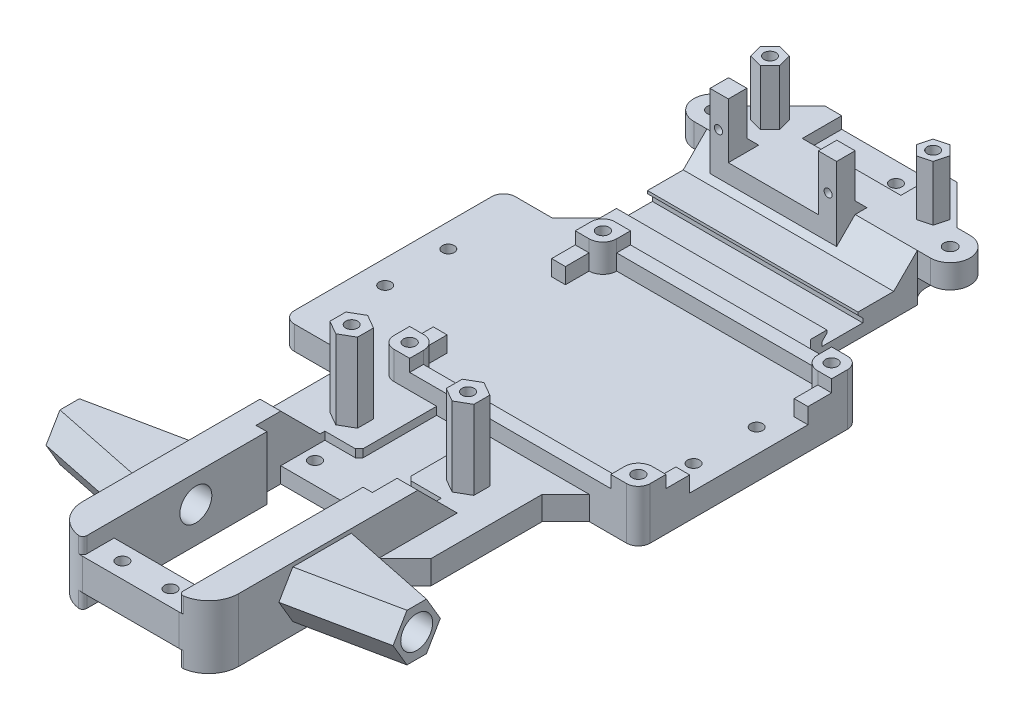
from build123d import *
from OCP.BRepFilletAPI import BRepFilletAPI_MakeChamfer
from build123d.topology import SkipClean

# Parameters (mm, degrees)
SKETCH1_R                 = 1.6
BOSS_EXTRUDE1_DEPTH       = 6
BOSS_EXTRUDE2_DEPTH       = 6
SKETCH3_W                 = 53.36675042
SKETCH3_H                 = 6
BOSS_EXTRUDE3_DEPTH       = 120
CUT_EXTRUDE1_DEPTH        = 58
CHAMFER1_SIZE             = 1
CHAMFER1_SIZE2            = 0.707106781
SKETCH7_W                 = 4.64125
SKETCH7_H                 = 4.7
BOSS_EXTRUDE5_DEPTH       = 20
SKETCH8_W                 = 22.8175
SKETCH8_H                 = 6
BOSS_EXTRUDE6_DEPTH       = 4.7
SKETCH9_R                 = 1.025
CUT_EXTRUDE2_DEPTH        = 18
SKETCH12_W                = 90.2
SKETCH12_H                = 56
BOSS_EXTRUDE11_DEPTH      = 6
SKETCH16_R                = 1.55
CUT_EXTRUDE3_DEPTH        = 13.1
SKETCH17_W                = 65
SKETCH17_H                = 56
SKETCH17_R                = 1.55
BOSS_EXTRUDE12_DEPTH      = 4
SKETCH18_R                = 1.55
BOSS_EXTRUDE13_DEPTH      = 3.1
SKETCH16_3_W              = 8.5
SKETCH16_3_H              = 11
SKETCH16_3_R              = 1.55
SKETCH16_3_W_2            = 12.1
CUT_EXTRUDE4_DEPTH        = 2
BOSS_EXTRUDE15_DEPTH      = 10
BOSS_EXTRUDE15_DEPTH_BACK = 6
CHAMFER2_SIZE             = 10
CHAMFER3_SIZE             = 10
SKETCH20_R                = 4.05
CUT_EXTRUDE5_DEPTH        = 47
BOSS_EXTRUDE16_START      = 0.4
SKETCH21_R                = 6
SKETCH21_R_2              = 4.05
BOSS_EXTRUDE16_DEPTH      = 0.4
SKETCH26_W                = 12
SKETCH26_H                = 12
BOSS_EXTRUDE17_DEPTH      = 24
CHAMFER5_SIZE             = 4.95
CHAMFER5_SIZE_2           = 24
CHAMFER8_SIZE             = 4.95
CHAMFER8_SIZE_2           = 24
CUT_EXTRUDE8_DEPTH        = 76
CUT_EXTRUDE8_DEPTH_BACK   = 24
SKETCH28_R                = 4.05
CUT_EXTRUDE9_START        = -9
SKETCH17_2_R              = 1.55
CUT_EXTRUDE9_DEPTH        = 9
CHAMFER10_SIZE            = 6
FILLET2_R                 = 3
CHAMFER11_SIZE            = 1
CHAMFER12_SIZE            = 3
FILLET3_R                 = 8
SKETCH29_W                = 30
SKETCH29_H                = 4
CUT_EXTRUDE10_DEPTH       = 97
SKETCH30_R                = 1.525
CUT_EXTRUDE11_DEPTH       = 9
SKETCH32_W                = 53.36675042
SKETCH32_H                = 10
BOSS_EXTRUDE18_DEPTH      = 12
CHAMFER13_SIZE            = 10
CHAMFER14_START           = -26.68337521
CHAMFER14_DEPTH           = 53.36675042
SKETCH33_W                = 25
SKETCH33_H                = 3
CUT_EXTRUDE12_DEPTH       = 10
SKETCH34_R                = 1.525
CUT_EXTRUDE13_DEPTH       = 10
SKETCH38_R                = 1.525
BOSS_EXTRUDE19_DEPTH      = 14
SKETCH39_R                = 1.525
BOSS_EXTRUDE20_DEPTH      = 20
FILLET4_R                 = 7.6
SKETCH40_W                = 24.4
SKETCH40_H                = 4
CUT_EXTRUDE14_DEPTH       = 10
FILLET6_R                 = 1
SKETCH42_R                = 1.525
CUT_EXTRUDE15_DEPTH       = 10


with BuildPart() as part:
    # Sketch1 → Boss-Extrude1 (new body)
    with BuildSketch(Plane(origin=(0, 0, 0), x_dir=(1, 0, 0), z_dir=(0, 1, 0))):
        with BuildLine():
            Line((-30, 5), (30, 5))
            ThreePointArc((30, 5), (35, 0), (30, -5))
            Line((30, -5), (-30, -5))
            ThreePointArc((-30, -5), (-35, 0), (-30, 5))
        make_face()
        with Locations(Location((-30, 0, 0), (0, 0, 270))):
            Circle(SKETCH1_R, mode=Mode.SUBTRACT)
        with Locations(Location((30, 0, 0), (0, 0, 270))):
            Circle(SKETCH1_R, mode=Mode.SUBTRACT)
    extrude(amount=BOSS_EXTRUDE1_DEPTH)

    # Sketch2 → Boss-Extrude2 (add)
    with BuildSketch(Plane.XZ):
        with BuildLine():
            Line((26.68337521, 5), (-26.68337521, 5))
            ThreePointArc((-26.68337521, 5), (-24, 0), (-26.68337521, -5))
            Line((-26.68337521, -5), (26.68337521, -5))
            ThreePointArc((26.68337521, -5), (24, 0), (26.68337521, 5))
        make_face()
    extrude(amount=BOSS_EXTRUDE2_DEPTH)

    # Sketch3 → Boss-Extrude3 (add)
    with BuildSketch(Plane.XY.offset(5)):
        with Locations((0, -3)):
            Rectangle(SKETCH3_W, SKETCH3_H)
    extrude(amount=BOSS_EXTRUDE3_DEPTH)

    # Sketch6 → Cut-Extrude1 (cut)
    with BuildSketch(Plane.ZY.offset(26.68337521)):
        Polygon((27.06627417, 0.16), (20.93372583, 0.16), (18.84, -1.93372583), (18.84, -3.00125), (29.16, -3.00125), (29.16, -1.93372583), align=None)
    extrude(amount=-CUT_EXTRUDE1_DEPTH, mode=Mode.SUBTRACT)

    # Chamfer1: one chamfer whose edges measure the first distance from different faces: ONE call of the kernel's chamfer builder (chamfer() names one face for all edges)
    chamfer1_edges_1 = [part.edges().sort_by_distance(p)[0] for p in [
        (0, 0, 27.22627417),
    ]]
    chamfer1_side_1 = [part.faces().sort_by_distance(p)[0] for p in [
        (0, -0.966862915, 28.193137085),
    ]]
    chamfer1_edges_2 = [part.edges().sort_by_distance(p)[0] for p in [
        (0, 0, 20.77372583),
    ]]
    chamfer1_side_2 = [part.faces().sort_by_distance(p)[0] for p in [
        (0, -0.966862915, 19.806862915),
    ]]
    chamfer1 = BRepFilletAPI_MakeChamfer(part.part.solid().wrapped)
    for e in chamfer1_edges_1:
        chamfer1.Add(CHAMFER1_SIZE, CHAMFER1_SIZE2, e.wrapped, chamfer1_side_1[0].wrapped)  # the first distance lies on this face
    for e in chamfer1_edges_2:
        chamfer1.Add(CHAMFER1_SIZE, CHAMFER1_SIZE2, e.wrapped, chamfer1_side_2[0].wrapped)  # the first distance lies on this face
    add(Compound.cast(chamfer1.Shape()), mode=Mode.REPLACE)

    # Sketch7 → Boss-Extrude5 (add)
    with BuildSketch(Plane(origin=(0, 0, 0), x_dir=(1, 0, 0), z_dir=(0, 1, 0))):
        with Locations((-18.879375, -7.35)):
            Rectangle(SKETCH7_W, SKETCH7_H)
        with Locations((8.579375, -7.35)):
            Rectangle(SKETCH7_W, SKETCH7_H)
    extrude(amount=BOSS_EXTRUDE5_DEPTH)

    # Sketch8 → Boss-Extrude6 (add)
    with BuildSketch(Plane.XY.offset(5)):
        with Locations((-5.15, 3)):
            Rectangle(SKETCH8_W, SKETCH8_H)
    extrude(amount=BOSS_EXTRUDE6_DEPTH)

    # Sketch9 → Cut-Extrude2 (cut)
    with BuildSketch(Plane.XY.offset(9.7)):
        with Locations((-19.05, 12)):
            Circle(SKETCH9_R)
        with Locations((8.75, 12)):
            Circle(SKETCH9_R)
    extrude(amount=-CUT_EXTRUDE2_DEPTH, mode=Mode.SUBTRACT)

    # Sketch12 → Boss-Extrude11 (add, through all)
    with BuildSketch(Plane(origin=(0, 0, 0), x_dir=(1, 0, 0), z_dir=(0, 1, 0))):
        with Locations((0, -66.16)):
            Rectangle(SKETCH12_W, SKETCH12_H)
    extrude(amount=-BOSS_EXTRUDE11_DEPTH)

    # Sketch16 → Cut-Extrude3 (cut)
    with BuildSketch(Plane(origin=(0, 0, 0), x_dir=(1, 0, 0), z_dir=(0, 1, 0))):
        with Locations(Location((-11.55, -119.5, 0), (0, 0, 270))):
            Circle(SKETCH16_R)
        with Locations(Location((11.55, -119.5, 0), (0, 0, 270))):
            Circle(SKETCH16_R)
    extrude(amount=-CUT_EXTRUDE3_DEPTH, mode=Mode.SUBTRACT)

    # Sketch17 → Boss-Extrude12 (add)
    with BuildSketch(Plane(origin=(0, 0, 0), x_dir=(1, 0, 0), z_dir=(0, 1, 0))):
        with Locations((12.6, -66.16)):
            Rectangle(SKETCH17_W, SKETCH17_H)
        with Locations(Location((-16.4, -41.66, 0), (0, 0, 270))):
            Circle(SKETCH17_R, mode=Mode.SUBTRACT)
        with Locations(Location((41.6, -41.66, 0), (0, 0, 270))):
            Circle(SKETCH17_R, mode=Mode.SUBTRACT)
        with Locations(Location((41.6, -90.66, 0), (0, 0, 270))):
            Circle(SKETCH17_R, mode=Mode.SUBTRACT)
        with Locations(Location((-16.4, -90.66, 0), (0, 0, 270))):
            Circle(SKETCH17_R, mode=Mode.SUBTRACT)
        with BuildLine():
            Line((41.6, -45.16), (41.6, -87.16))
            ThreePointArc((41.6, -87.16), (39.125126266, -88.185126266), (38.1, -90.66))
            Line((38.1, -90.66), (-12.9, -90.66))
            ThreePointArc((-12.9, -90.66), (-13.925126266, -88.185126266), (-16.4, -87.16))
            Line((-16.4, -87.16), (-16.4, -45.16))
            ThreePointArc((-16.4, -45.16), (-13.925126266, -44.134873734), (-12.9, -41.66))
            Line((-12.9, -41.66), (38.1, -41.66))
            ThreePointArc((38.1, -41.66), (39.125126266, -44.134873734), (41.6, -45.16))
        make_face(mode=Mode.SUBTRACT)
    extrude(amount=BOSS_EXTRUDE12_DEPTH)

    # Sketch18 → Boss-Extrude13 (add)
    # profile 1 of 4: a face of its own
    with BuildSketch(Plane(origin=(0, 4, 0), x_dir=(1, 0, 0), z_dir=(0, 1, 0))):
        with BuildLine():
            Line((-16.4, -45.16), (-19.9, -45.16))
            Line((-19.9, -45.16), (-19.9, -38.16))
            Line((-19.9, -38.16), (-12.9, -38.16))
            Line((-12.9, -38.16), (-12.9, -41.66))
            ThreePointArc((-12.9, -41.66), (-13.925126266, -44.134873734), (-16.4, -45.16))
        make_face()
        with Locations(Location((-16.4, -41.66, 0), (0, 0, 270))):
            Circle(SKETCH18_R, mode=Mode.SUBTRACT)
    # profile 2 of 4: a face of its own
    with BuildSketch(Plane(origin=(0, 4, 0), x_dir=(1, 0, 0), z_dir=(0, 1, 0))):
        with BuildLine():
            Line((-16.4, -87.16), (-19.9, -87.16))
            Line((-19.9, -87.16), (-19.9, -94.16))
            Line((-19.9, -94.16), (-12.9, -94.16))
            Line((-12.9, -94.16), (-12.9, -90.66))
            ThreePointArc((-12.9, -90.66), (-13.925126266, -88.185126266), (-16.4, -87.16))
        make_face()
        with Locations(Location((-16.4, -90.66, 0), (0, 0, 270))):
            Circle(SKETCH18_R, mode=Mode.SUBTRACT)
    # profile 3 of 4: a face of its own
    with BuildSketch(Plane(origin=(0, 4, 0), x_dir=(1, 0, 0), z_dir=(0, 1, 0))):
        with BuildLine():
            Line((38.1, -94.16), (38.1, -90.66))
            ThreePointArc((38.1, -90.66), (39.125126266, -88.185126266), (41.6, -87.16))
            Line((41.6, -87.16), (45.1, -87.16))
            Line((45.1, -87.16), (45.1, -94.16))
            Line((45.1, -94.16), (38.1, -94.16))
        make_face()
        with Locations(Location((41.6, -90.66, 0), (0, 0, 90))):
            Circle(SKETCH18_R, mode=Mode.SUBTRACT)
    # profile 4 of 4: a face of its own
    with BuildSketch(Plane(origin=(0, 4, 0), x_dir=(1, 0, 0), z_dir=(0, 1, 0))):
        with BuildLine():
            Line((38.1, -38.16), (38.1, -41.66))
            ThreePointArc((38.1, -41.66), (39.125126266, -44.134873734), (41.6, -45.16))
            Line((41.6, -45.16), (45.1, -45.16))
            Line((45.1, -45.16), (45.1, -38.16))
            Line((45.1, -38.16), (38.1, -38.16))
        make_face()
        with Locations(Location((41.6, -41.66, 0), (0, 0, 90))):
            Circle(SKETCH18_R, mode=Mode.SUBTRACT)
    extrude(amount=BOSS_EXTRUDE13_DEPTH)

    # Sketch16<3> → Cut-Extrude4 (cut)
    # profile 1 of 6: a face of its own
    with BuildSketch(Plane(origin=(0, 0, 0), x_dir=(1, 0, 0), z_dir=(0, 1, 0))):
        with Locations((-10.3, -119.5)):
            Rectangle(SKETCH16_3_W, SKETCH16_3_H)
        with Locations(Location((-11.55, -119.5, 0), (0, 0, 270))):
            Circle(SKETCH16_3_R, mode=Mode.SUBTRACT)
    # profile 2 of 6: a face of its own
    with BuildSketch(Plane(origin=(0, 0, 0), x_dir=(1, 0, 0), z_dir=(0, 1, 0))):
        with Locations((0, -119.5)):
            Rectangle(SKETCH16_3_W_2, SKETCH16_3_H)
    # profile 3 of 6: a face of its own
    with BuildSketch(Plane(origin=(0, 0, 0), x_dir=(1, 0, 0), z_dir=(0, 1, 0))):
        Polygon((-6.05, -113.8), (-6.05, -114), (6.05, -114), (6.05, -113.8), (6.05, -94.16), (-6.05, -94.16), align=None)
    # profile 4 of 6: a face of its own
    with BuildSketch(Plane(origin=(0, 0, 0), x_dir=(1, 0, 0), z_dir=(0, 1, 0))):
        with Locations((10.3, -119.5)):
            Rectangle(SKETCH16_3_W, SKETCH16_3_H)
        with Locations(Location((11.55, -119.5, 0), (0, 0, 270))):
            Circle(SKETCH16_3_R, mode=Mode.SUBTRACT)
    # profile 5 of 6: a face of its own
    with BuildSketch(Plane(origin=(0, 0, 0), x_dir=(1, 0, 0), z_dir=(0, 1, 0))):
        Polygon((-14.55, -114), (-6.05, -114), (-6.05, -113.8), (-14.75, -113.8), (-14.75, -125), (-14.55, -125), align=None)
    # profile 6 of 6: a face of its own
    with BuildSketch(Plane(origin=(0, 0, 0), x_dir=(1, 0, 0), z_dir=(0, 1, 0))):
        Polygon((6.05, -113.8), (6.05, -114), (14.55, -114), (14.55, -125), (14.75, -125), (14.75, -113.8), align=None)
    extrude(amount=-CUT_EXTRUDE4_DEPTH, mode=Mode.SUBTRACT)

    # Sketch19 → Boss-Extrude15 (add, two sides: drawn at the far end of the back side and taken through both)
    with BuildSketch(Plane(origin=(0, 0, 0), x_dir=(1, 0, 0), z_dir=(0, 1, 0)).offset(-BOSS_EXTRUDE15_DEPTH_BACK)):
        Polygon((-14.75, -125), (-20, -125), (-20, -178), (20, -178), (20, -125), (14.75, -125), (14.75, -131.262219981), (12.4, -131.262219981), (12.4, -170), (12, -170), (-12, -170), (-12, -131.262219981), (-14.75, -131.262219981), align=None)
    extrude(amount=BOSS_EXTRUDE15_DEPTH + BOSS_EXTRUDE15_DEPTH_BACK)

    # Chamfer2
    # the kernel refuses this chamfer: 10 mm, written as the material it adds along each edge
    with BuildSketch(Plane(origin=(20, -6, 125), x_dir=(1, 0, 0), z_dir=(0, 1, 0))) as chamfer2_piece_1_section:
        Polygon((CHAMFER2_SIZE, 0), (0, -CHAMFER2_SIZE), (0, 0), align=None)
    chamfer2_piece_1 = extrude(amount=6, mode=Mode.PRIVATE)
    chamfer2_piece_1 = split(chamfer2_piece_1, bisect_by=Plane(origin=(26.68337521, -6, 125), z_dir=(-1, 0, 0)), keep=Keep.TOP, mode=Mode.PRIVATE)
    add(chamfer2_piece_1)
    with BuildSketch(Plane(origin=(-20, -6, 125), x_dir=(-1, 0, 0), z_dir=(0, 1, 0))) as chamfer2_piece_2_section:
        Polygon((CHAMFER2_SIZE, 0), (0, CHAMFER2_SIZE), (0, 0), align=None)
    chamfer2_piece_2 = extrude(amount=6, mode=Mode.PRIVATE)
    chamfer2_piece_2 = split(chamfer2_piece_2, bisect_by=Plane(origin=(-26.68337521, -6, 125), z_dir=(1, 0, 0)), keep=Keep.TOP, mode=Mode.PRIVATE)
    add(chamfer2_piece_2)

    # Chamfer3
    chamfer3_edges = [part.edges().sort_by_distance(p)[0] for p in [
        (-17.375, 0, 125),
        (17.375, 0, 125),
    ]]
    chamfer(chamfer3_edges, length=CHAMFER3_SIZE - 0.0001)  # a hair under: the kernel refuses the full size

    # Sketch20 → Cut-Extrude5 (cut)
    with BuildSketch(Plane.ZY.offset(20)):
        with Locations((149.27, 3)):
            Circle(SKETCH20_R)
    cut_extrude5 = extrude(amount=-CUT_EXTRUDE5_DEPTH, mode=Mode.SUBTRACT)

    # Sketch21 → Boss-Extrude16 (add)
    with BuildSketch(Plane.ZY.offset(-12.4).offset(BOSS_EXTRUDE16_START)):
        with Locations((149.27, 3)):
            Circle(SKETCH21_R)
        with Locations((149.27, 3)):
            Circle(SKETCH21_R_2, mode=Mode.SUBTRACT)
    extrude(amount=-BOSS_EXTRUDE16_DEPTH)

    # Sketch26 → Boss-Extrude17 (add)
    with BuildSketch(Plane.ZY.offset(20)):
        with Locations((149.27, 3)):
            Rectangle(SKETCH26_W, SKETCH26_H)
    boss_extrude17 = extrude(amount=BOSS_EXTRUDE17_DEPTH)

    # Chamfer5
    chamfer5_edges_1 = [part.edges().sort_by_distance(p)[0] for p in [
        (-20, 3, 143.27),
    ]]
    chamfer5_side_1 = [part.faces().sort_by_distance(p)[0] for p in [
        (-20, 3, 143.171),
    ]]
    chamfer5_edges_2 = [part.edges().sort_by_distance(p)[0] for p in [
        (-20, 3, 155.27),
    ]]
    chamfer5_side_2 = [part.faces().sort_by_distance(p)[0] for p in [
        (-20, 3, 155.369),
    ]]
    chamfer5 = BRepFilletAPI_MakeChamfer(part.part.solid().wrapped)
    for e in chamfer5_edges_1:
        chamfer5.Add(CHAMFER5_SIZE - 0.0001, CHAMFER5_SIZE_2 - 0.0001, e.wrapped, chamfer5_side_1[0].wrapped)
    for e in chamfer5_edges_2:
        chamfer5.Add(CHAMFER5_SIZE - 0.0001, CHAMFER5_SIZE_2 - 0.0001, e.wrapped, chamfer5_side_2[0].wrapped)
    add(Compound.cast(chamfer5.Shape()), mode=Mode.REPLACE)  # a hair under: the kernel refuses the full size

    # Chamfer6
    # the kernel refuses this chamfer: 6, 3.464101615 mm, written as the material it takes off along each edge
    with BuildSketch(Plane(origin=(-4.797458733, 9, 163.355373857), x_dir=(0, -1, 0), z_dir=(-0.9793865059209337, 0, -0.20199522771586734))) as chamfer6_piece_1_section:
        with BuildLine():
            Line((6.207846097, 0.12), (-0.207846097, -3.584101615))
            Line((-0.207846097, -3.584101615), (-0.327846097, -3.584101615))
            ThreePointArc((-0.327846097, -3.584101615), (-0.12, -1.792050808), (-0.12, 0))
            Line((-0.12, 0), (0, 0.12))
            ThreePointArc((0, 0.12), (3.103923048, 0.12), (6.207846097, 0.24))
            Line((6.207846097, 0.24), (6.207846097, 0.12))
        make_face()
    chamfer6_piece_1 = extrude(amount=55.550063437, mode=Mode.PRIVATE)
    chamfer6_piece_1 = split(chamfer6_piece_1, bisect_by=Plane(origin=(-20, 9, 163.355373857), z_dir=(-1, 0, 0)), keep=Keep.TOP, mode=Mode.PRIVATE)
    add(chamfer6_piece_1, mode=Mode.SUBTRACT)
    with BuildSketch(Plane(origin=(-4.797458733, -3, 163.355373857), x_dir=(0, 1, 0), z_dir=(-0.9793865059209337, 0, -0.20199522771586734))) as chamfer6_piece_2_section:
        with BuildLine():
            Line((6.207846097, -0.12), (-0.207846097, 3.584101615))
            Line((-0.207846097, 3.584101615), (-0.327846097, 3.584101615))
            ThreePointArc((-0.327846097, 3.584101615), (-0.12, 1.792050808), (-0.12, 0))
            Line((-0.12, 0), (0, -0.12))
            ThreePointArc((0, -0.12), (3.103923048, -0.12), (6.207846097, -0.24))
            Line((6.207846097, -0.24), (6.207846097, -0.12))
        make_face()
    chamfer6_piece_2 = extrude(amount=55.550063437, mode=Mode.PRIVATE)
    chamfer6_piece_2 = split(chamfer6_piece_2, bisect_by=Plane(origin=(-20, -3, 163.355373857), z_dir=(-1, 0, 0)), keep=Keep.TOP, mode=Mode.PRIVATE)
    add(chamfer6_piece_2, mode=Mode.SUBTRACT)
    with BuildSketch(Plane(origin=(-4.797458733, -3, 135.184626143), x_dir=(0.20199522771586728, 0, 0.9793865059209336), z_dir=(-0.9793865059209337, 0, 0.20199522771586734))) as chamfer6_piece_3_section:
        with BuildLine():
            Line((3.584101615, -0.207846097), (-0.12, 6.207846097))
            Line((-0.12, 6.207846097), (-0.24, 6.207846097))
            ThreePointArc((-0.24, 6.207846097), (-0.12, 3.103923048), (-0.12, 0))
            Line((-0.12, 0), (0, -0.12))
            ThreePointArc((0, -0.12), (1.792050808, -0.12), (3.584101615, -0.327846097))
            Line((3.584101615, -0.327846097), (3.584101615, -0.207846097))
        make_face()
    chamfer6_piece_3 = extrude(amount=55.550063437, mode=Mode.PRIVATE)
    chamfer6_piece_3 = split(chamfer6_piece_3, bisect_by=Plane(origin=(-20, -3, 135.184626143), z_dir=(-1, 0, 0)), keep=Keep.TOP, mode=Mode.PRIVATE)
    add(chamfer6_piece_3, mode=Mode.SUBTRACT)
    with BuildSketch(Plane(origin=(-4.797458733, 9, 135.184626143), x_dir=(0, -1, 0), z_dir=(-0.9793865059209337, 0, 0.20199522771586734))) as chamfer6_piece_4_section:
        with BuildLine():
            Line((6.207846097, -0.12), (-0.207846097, 3.584101615))
            Line((-0.207846097, 3.584101615), (-0.327846097, 3.584101615))
            ThreePointArc((-0.327846097, 3.584101615), (-0.12, 1.792050808), (-0.12, 0))
            Line((-0.12, 0), (0, -0.12))
            ThreePointArc((0, -0.12), (3.103923048, -0.12), (6.207846097, -0.24))
            Line((6.207846097, -0.24), (6.207846097, -0.12))
        make_face()
    chamfer6_piece_4 = extrude(amount=55.550063437, mode=Mode.PRIVATE)
    chamfer6_piece_4 = split(chamfer6_piece_4, bisect_by=Plane(origin=(-20, 9, 135.184626143), z_dir=(-1, 0, 0)), keep=Keep.TOP, mode=Mode.PRIVATE)
    add(chamfer6_piece_4, mode=Mode.SUBTRACT)

    # Mirror19: Cut-Extrude5, Boss-Extrude17 across plane
    add(cut_extrude5.mirror(Plane(origin=(0, 0, 0), x_dir=(0, 0, 1), z_dir=(1, 0, 0))), mode=Mode.SUBTRACT)
    add(boss_extrude17.mirror(Plane(origin=(0, 0, 0), x_dir=(0, 0, 1), z_dir=(1, 0, 0))))

    # Chamfer8
    chamfer8_edges_1 = [part.edges().sort_by_distance(p)[0] for p in [
        (20, 3, 143.27),
    ]]
    chamfer8_side_1 = [part.faces().sort_by_distance(p)[0] for p in [
        (20, 3, 143.171),
    ]]
    chamfer8_edges_2 = [part.edges().sort_by_distance(p)[0] for p in [
        (20, 3, 155.27),
    ]]
    chamfer8_side_2 = [part.faces().sort_by_distance(p)[0] for p in [
        (20, 3, 155.369),
    ]]
    chamfer8 = BRepFilletAPI_MakeChamfer(part.part.solid().wrapped)
    for e in chamfer8_edges_1:
        chamfer8.Add(CHAMFER8_SIZE - 0.0001, CHAMFER8_SIZE_2 - 0.0001, e.wrapped, chamfer8_side_1[0].wrapped)
    for e in chamfer8_edges_2:
        chamfer8.Add(CHAMFER8_SIZE - 0.0001, CHAMFER8_SIZE_2 - 0.0001, e.wrapped, chamfer8_side_2[0].wrapped)
    add(Compound.cast(chamfer8.Shape()), mode=Mode.REPLACE)  # a hair under: the kernel refuses the full size

    # Chamfer9
    # the kernel refuses this chamfer: 6, 3.464101615 mm, written as the material it takes off along each edge
    with BuildSketch(Plane(origin=(4.797458733, 9, 135.184626143), x_dir=(-0.20199522771586723, 0, 0.9793865059209336), z_dir=(0.9793865059209337, 0, 0.20199522771586723))) as chamfer9_piece_1_section:
        with BuildLine():
            Line((3.584101615, -0.207846097), (-0.12, 6.207846097))
            Line((-0.12, 6.207846097), (-0.24, 6.207846097))
            ThreePointArc((-0.24, 6.207846097), (-0.12, 3.103923048), (-0.12, 0))
            Line((-0.12, 0), (0, -0.12))
            ThreePointArc((0, -0.12), (1.792050808, -0.12), (3.584101615, -0.327846097))
            Line((3.584101615, -0.327846097), (3.584101615, -0.207846097))
        make_face()
    chamfer9_piece_1 = extrude(amount=55.550063437, mode=Mode.PRIVATE)
    chamfer9_piece_1 = split(chamfer9_piece_1, bisect_by=Plane(origin=(20, 9, 135.184626143), z_dir=(1, 0, 0)), keep=Keep.TOP, mode=Mode.PRIVATE)
    add(chamfer9_piece_1, mode=Mode.SUBTRACT)
    with BuildSketch(Plane(origin=(4.797458733, -3, 135.184626143), x_dir=(-0.2019952277158672, 0, 0.9793865059209336), z_dir=(0.9793865059209337, 0, 0.20199522771586723))) as chamfer9_piece_2_section:
        with BuildLine():
            Line((3.584101615, 0.207846097), (-0.12, -6.207846097))
            Line((-0.12, -6.207846097), (-0.24, -6.207846097))
            ThreePointArc((-0.24, -6.207846097), (-0.12, -3.103923048), (-0.12, 0))
            Line((-0.12, 0), (0, 0.12))
            ThreePointArc((0, 0.12), (1.792050808, 0.12), (3.584101615, 0.327846097))
            Line((3.584101615, 0.327846097), (3.584101615, 0.207846097))
        make_face()
    chamfer9_piece_2 = extrude(amount=55.550063437, mode=Mode.PRIVATE)
    chamfer9_piece_2 = split(chamfer9_piece_2, bisect_by=Plane(origin=(20, -3, 135.184626143), z_dir=(1, 0, 0)), keep=Keep.TOP, mode=Mode.PRIVATE)
    add(chamfer9_piece_2, mode=Mode.SUBTRACT)
    with BuildSketch(Plane(origin=(4.797458733, -3, 163.355373857), x_dir=(-0.20199522771586723, 0, -0.9793865059209336), z_dir=(0.9793865059209337, 0, -0.20199522771586723))) as chamfer9_piece_3_section:
        with BuildLine():
            Line((3.584101615, -0.207846097), (-0.12, 6.207846097))
            Line((-0.12, 6.207846097), (-0.24, 6.207846097))
            ThreePointArc((-0.24, 6.207846097), (-0.12, 3.103923048), (-0.12, 0))
            Line((-0.12, 0), (0, -0.12))
            ThreePointArc((0, -0.12), (1.792050808, -0.12), (3.584101615, -0.327846097))
            Line((3.584101615, -0.327846097), (3.584101615, -0.207846097))
        make_face()
    chamfer9_piece_3 = extrude(amount=55.550063437, mode=Mode.PRIVATE)
    chamfer9_piece_3 = split(chamfer9_piece_3, bisect_by=Plane(origin=(20, -3, 163.355373857), z_dir=(1, 0, 0)), keep=Keep.TOP, mode=Mode.PRIVATE)
    add(chamfer9_piece_3, mode=Mode.SUBTRACT)
    with BuildSketch(Plane(origin=(4.797458733, 9, 163.355373857), x_dir=(0, -1, 0), z_dir=(0.9793865059209337, 0, -0.20199522771586723))) as chamfer9_piece_4_section:
        with BuildLine():
            Line((6.207846097, -0.12), (-0.207846097, 3.584101615))
            Line((-0.207846097, 3.584101615), (-0.327846097, 3.584101615))
            ThreePointArc((-0.327846097, 3.584101615), (-0.12, 1.792050808), (-0.12, 0))
            Line((-0.12, 0), (0, -0.12))
            ThreePointArc((0, -0.12), (3.103923048, -0.12), (6.207846097, -0.24))
            Line((6.207846097, -0.24), (6.207846097, -0.12))
        make_face()
    chamfer9_piece_4 = extrude(amount=55.550063437, mode=Mode.PRIVATE)
    chamfer9_piece_4 = split(chamfer9_piece_4, bisect_by=Plane(origin=(20, 9, 163.355373857), z_dir=(1, 0, 0)), keep=Keep.TOP, mode=Mode.PRIVATE)
    add(chamfer9_piece_4, mode=Mode.SUBTRACT)

    # Sketch28 → Cut-Extrude8 (cut, two sides: drawn at the far end of the back side and taken through both)
    with SkipClean():  # the faces are left unmerged after this step: merging them gives an invalid solid
        with BuildSketch(Plane(origin=(-27, 0, 0), x_dir=(0, 0, -1), z_dir=(1, 0, 0)).offset(-CUT_EXTRUDE8_DEPTH_BACK)):
            with Locations((-149.27, 3)):
                Circle(SKETCH28_R)
        extrude(amount=CUT_EXTRUDE8_DEPTH + CUT_EXTRUDE8_DEPTH_BACK, mode=Mode.SUBTRACT)

    # Sketch17<2> → Cut-Extrude9 (cut)
    with BuildSketch(Plane(origin=(0, 0, 0), x_dir=(1, 0, 0), z_dir=(0, 1, 0)).offset(CUT_EXTRUDE9_START)):
        with Locations(Location((-16.4, -41.66, 0), (0, 0, 90))):
            Circle(SKETCH17_2_R)
        with Locations(Location((41.6, -41.66, 0), (0, 0, 90))):
            Circle(SKETCH17_2_R)
        with Locations(Location((41.6, -90.66, 0), (0, 0, 90))):
            Circle(SKETCH17_2_R)
        with Locations(Location((-16.4, -90.66, 0), (0, 0, 90))):
            Circle(SKETCH17_2_R)
    extrude(amount=CUT_EXTRUDE9_DEPTH, mode=Mode.SUBTRACT)

    # Chamfer10
    chamfer10_edges = [part.edges().sort_by_distance(p)[0] for p in [
        (-26.68337521, -3, 94.16),
        (26.68337521, -3, 94.16),
        (-26.68337521, -3, 38.16),
        (26.68337521, -3, 38.16),
    ]]
    chamfer(chamfer10_edges, length=CHAMFER10_SIZE)

    # Fillet2
    fillet2_edges = [part.edges().sort_by_distance(p)[0] for p in [
        (45.1, 0.55, 94.16),
        (-45.1, -3, 38.16),
        (-45.1, -3, 94.16),
        (45.1, 0.55, 38.16),
        (-19.9, 3.55, 38.16),
        (-19.9, 3.55, 94.16),
    ]]
    fillet(fillet2_edges, radius=FILLET2_R)

    # Chamfer11
    chamfer11_edges = [part.edges().sort_by_distance(p)[0] for p in [
        (-6.05, -1, 113.8),
        (6.05, -1, 113.8),
    ]]
    chamfer(chamfer11_edges, length=CHAMFER11_SIZE)

    # Chamfer12
    chamfer12_edges = [part.edges().sort_by_distance(p)[0] for p in [
        (8.579375, 6, 5),
        (-18.879375, 6, 5),
    ]]
    chamfer(chamfer12_edges, length=CHAMFER12_SIZE)

    # Fillet3
    fillet3_edges = [part.edges().sort_by_distance(p)[0] for p in [
        (-20, 2, 178),
    ]]
    fillet(fillet3_edges, radius=FILLET3_R)

    # Sketch29 → Cut-Extrude10 (cut)
    with BuildSketch(Plane.ZY.offset(45.1)):
        with Locations((66.16, 2)):
            Rectangle(SKETCH29_W, SKETCH29_H)
    extrude(amount=-CUT_EXTRUDE10_DEPTH, mode=Mode.SUBTRACT)

    # Sketch30 → Cut-Extrude11 (cut)
    with BuildSketch(Plane(origin=(0, 0, 0), x_dir=(1, 0, 0), z_dir=(0, 1, 0))):
        with Locations(Location((-39.1, -58.16, 0), (0, 0, 270))):
            Circle(SKETCH30_R)
        with Locations(Location((-39.1, -74.16, 0), (0, 0, 270))):
            Circle(SKETCH30_R)
    cut_extrude11 = extrude(amount=-CUT_EXTRUDE11_DEPTH, mode=Mode.SUBTRACT)

    # Mirror20: Cut-Extrude11 across plane
    add(cut_extrude11.mirror(Plane(origin=(0, 0, 0), x_dir=(0, 0, 1), z_dir=(1, 0, 0))), mode=Mode.SUBTRACT)

    # Sketch32 → Boss-Extrude18 (add)
    with BuildSketch(Plane.XZ.offset(6)):
        with Locations((0, -10)):
            Rectangle(SKETCH32_W, SKETCH32_H)
    extrude(amount=-BOSS_EXTRUDE18_DEPTH)

    # Chamfer13
    chamfer13_edges = [part.edges().sort_by_distance(p)[0] for p in [
        (-26.68337521, 0, -15),
        (26.68337521, 0, -15),
    ]]
    chamfer(chamfer13_edges, length=CHAMFER13_SIZE - 0.0001)  # a hair under: the kernel refuses the full size

    # Chamfer14: read off the stored shape, not the designer's step
    # Chamfer14 outline → Chamfer14 (add)
    with BuildSketch(Plane.YZ.offset(CHAMFER14_START)):
        Polygon((0, 5), (6, 5), (0, 11), align=None)
    extrude(amount=CHAMFER14_DEPTH)

    # Sketch33 → Cut-Extrude12 (cut)
    with BuildSketch(Plane(origin=(0, 0, -15), x_dir=(-1, 0, 0), z_dir=(0, 0, -1))):
        with Locations((0, -4.5)):
            Rectangle(SKETCH33_W, SKETCH33_H)
        with Locations((0, 4.5)):
            Rectangle(SKETCH33_W, SKETCH33_H)
    extrude(amount=-CUT_EXTRUDE12_DEPTH, mode=Mode.SUBTRACT)

    # Sketch34 → Cut-Extrude13 (cut)
    with BuildSketch(Plane(origin=(0, 3, 0), x_dir=(1, 0, 0), z_dir=(0, 1, 0))):
        with Locations(Location((-6.25, 10, 0), (0, 0, 270))):
            Circle(SKETCH34_R)
        with Locations(Location((6.25, 10, 0), (0, 0, 270))):
            Circle(SKETCH34_R)
    extrude(amount=-CUT_EXTRUDE13_DEPTH, mode=Mode.SUBTRACT)

    # Sketch38 → Boss-Extrude19 (add)
    # profile 1 of 2: a face of its own
    with BuildSketch(Plane(origin=(0, 6, 0), x_dir=(1, 0, 0), z_dir=(0, 1, 0))):
        Polygon((-17.337309995, 4.103424528), (-18.233885467, 7.449489743), (-21.579950682, 8.346065215), (-24.029440425, 5.896575472), (-23.132864952, 2.550510257), (-19.786799737, 1.653934785), align=None)
        with Locations(Location((-20.68337521, 5, 0), (0, 0, 270))):
            Circle(SKETCH38_R, mode=Mode.SUBTRACT)
    # profile 2 of 2: a face of its own
    with BuildSketch(Plane(origin=(0, 6, 0), x_dir=(1, 0, 0), z_dir=(0, 1, 0))):
        Polygon((19.786799737, 1.653934785), (17.337309995, 4.103424528), (18.233885467, 7.449489743), (21.579950682, 8.346065215), (24.029440425, 5.896575472), (23.132864952, 2.550510257), align=None)
        with Locations(Location((20.68337521, 5, 0), (0, 0, 270))):
            Circle(SKETCH38_R, mode=Mode.SUBTRACT)
    extrude(amount=BOSS_EXTRUDE19_DEPTH)

    # Sketch39 → Boss-Extrude20 (add)
    # profile 1 of 2: a face of its own
    with BuildSketch(Plane(origin=(0, 0, 0), x_dir=(1, 0, 0), z_dir=(0, 1, 0))):
        Polygon((-14.75, -102.958548116), (-18.25, -104.979274058), (-18.25, -109.020725942), (-14.75, -111.041451884), (-11.25, -109.020725942), (-11.25, -104.979274058), align=None)
        with Locations(Location((-14.75, -107, 0), (0, 0, 270))):
            Circle(SKETCH39_R, mode=Mode.SUBTRACT)
    # profile 2 of 2: a face of its own
    with BuildSketch(Plane(origin=(0, 0, 0), x_dir=(1, 0, 0), z_dir=(0, 1, 0))):
        Polygon((11.25, -104.979274058), (14.75, -102.958548116), (18.25, -104.979274058), (18.25, -109.020725942), (14.75, -111.041451884), (11.25, -109.020725942), align=None)
        with Locations(Location((14.75, -107, 0), (0, 0, 90))):
            Circle(SKETCH39_R, mode=Mode.SUBTRACT)
    extrude(amount=BOSS_EXTRUDE20_DEPTH)

    # Fillet4
    fillet4_edges = [part.edges().sort_by_distance(p)[0] for p in [
        (20, 2, 178),
    ]]
    fillet(fillet4_edges, radius=FILLET4_R)

    # Sketch40 → Cut-Extrude14 (cut)
    with BuildSketch(Plane.XY.offset(178)):
        with Locations((0.2, 8)):
            Rectangle(SKETCH40_W, SKETCH40_H)
        with Locations((0.2, -4)):
            Rectangle(SKETCH40_W, SKETCH40_H)
    extrude(amount=-CUT_EXTRUDE14_DEPTH, mode=Mode.SUBTRACT)

    # Fillet6
    fillet6_edges = [part.edges().sort_by_distance(p)[0] for p in [
        (12.4, -4, 178),
        (12.4, 8, 178),
        (-12, -4, 178),
        (-12, 8, 178),
    ]]
    fillet(fillet6_edges, radius=FILLET6_R)

    # Sketch42 → Cut-Extrude15 (cut)
    with BuildSketch(Plane(origin=(0, 6, 0), x_dir=(1, 0, 0), z_dir=(0, 1, 0))):
        with Locations(Location((-5.9, -174, 0), (0, 0, 270))):
            Circle(SKETCH42_R)
        with Locations(Location((6.3, -174, 0), (0, 0, 90))):
            Circle(SKETCH42_R)
    extrude(amount=-CUT_EXTRUDE15_DEPTH, mode=Mode.SUBTRACT)


solid = part.part
